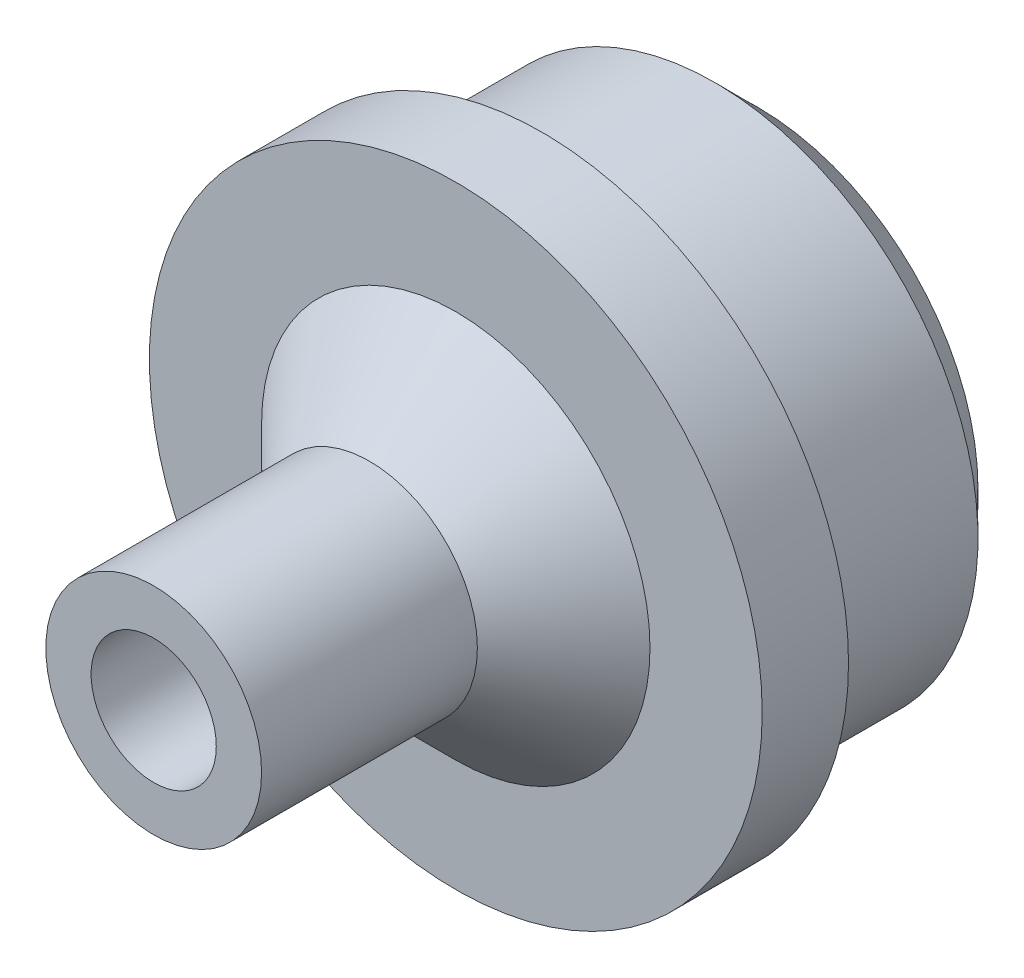
from build123d import *

# Parameters (mm, degrees)
EXTRUDE_1_DEPTH     = 5
SKETCH_2_R          = 7.1
EXTRUDE_2_DEPTH     = 2
SKETCH_3_R          = 2.5
EXTRUDE_3_DEPTH     = 7
CHAMFER_1_SIZE      = 2
SKETCH_4_R          = 1.45
CUT_EXTRUDE_1_DEPTH = 30
CHAMFER_2_SIZE      = 1


with BuildPart() as part:
    # ｽｹｯﾁ1 → ﾎﾞｽ - 押し出し1 (new body)
    with BuildSketch(Plane.XY):
        with BuildLine():
            ThreePointArc((-6.036917674, -0.875), (6.1, 0), (-6.036917674, 0.875))
            Line((-6.036917674, 0.875), (-6.35, 0.875))
            Line((-6.35, 0.875), (-6.35, -0.875))
            Line((-6.35, -0.875), (-6.036917674, -0.875))
        make_face()
    extrude(amount=-EXTRUDE_1_DEPTH)

    # ｽｹｯﾁ2 → ﾎﾞｽ - 押し出し2 (add)
    with BuildSketch(Plane.XY):
        Circle(SKETCH_2_R)
    extrude(amount=EXTRUDE_2_DEPTH)

    # ｽｹｯﾁ3 → ﾎﾞｽ - 押し出し3 (add)
    with BuildSketch(Plane.XY.offset(2)):
        Circle(SKETCH_3_R)
    extrude(amount=EXTRUDE_3_DEPTH)

    # 面取り1
    chamfer_1_edges = [part.edges().sort_by_distance(p)[0] for p in [
        (-2.5, 0, 2),
    ]]
    chamfer(chamfer_1_edges, length=CHAMFER_1_SIZE)

    # ｽｹｯﾁ4 → ｶｯﾄ - 押し出し1 (cut)
    with BuildSketch(Plane.XY.offset(9)):
        Circle(SKETCH_4_R)
    extrude(amount=-CUT_EXTRUDE_1_DEPTH, mode=Mode.SUBTRACT)

    # 面取り2
    chamfer_2_edges = [part.edges().sort_by_distance(p)[0] for p in [
        (6.1, 0, -5),
    ]]
    chamfer(chamfer_2_edges, length=CHAMFER_2_SIZE)


solid = part.part
